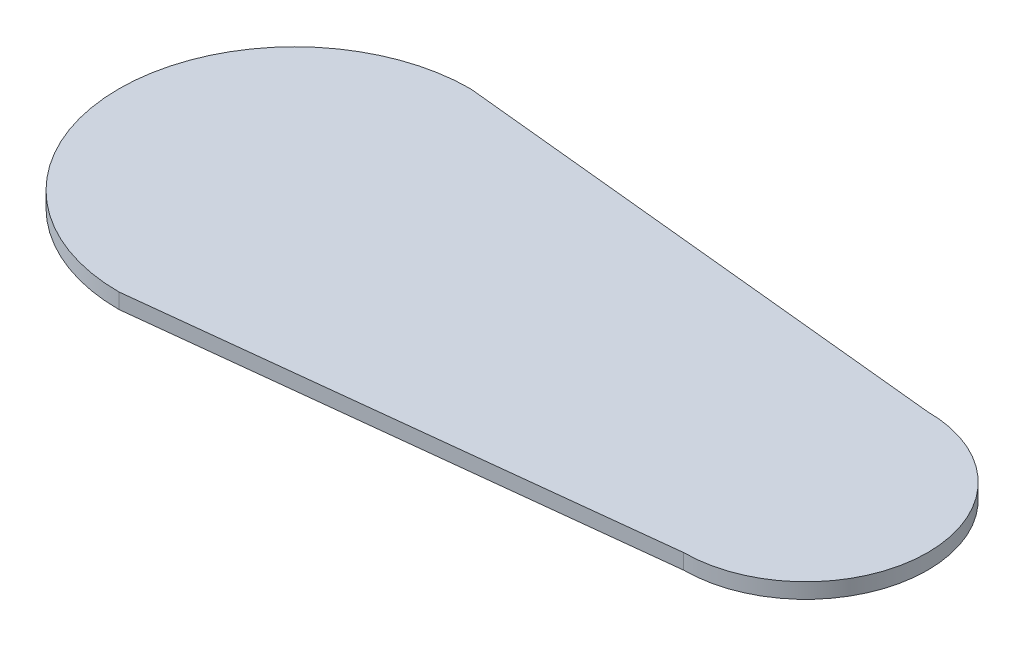
from build123d import *

# Parameters (mm, degrees)
BOSS_EXTRUDE2_DEPTH = 3


with BuildPart() as part:
    # Sketch2 → Boss-Extrude2 (new body)
    with BuildSketch(Plane(origin=(0, 0, 0), x_dir=(1, 0, 0), z_dir=(0, 1, 0))):
        with BuildLine():
            Line((-100, 58.061579531), (0, 48))
            ThreePointArc((0, 48), (24, 24), (0, 0))
            Line((0, 0), (-100, -11.145771569))
            ThreePointArc((-100, -11.145771569), (-134.60367555, 23.457903981), (-100, 58.061579531))
        make_face()
    extrude(amount=BOSS_EXTRUDE2_DEPTH)


solid = part.part
